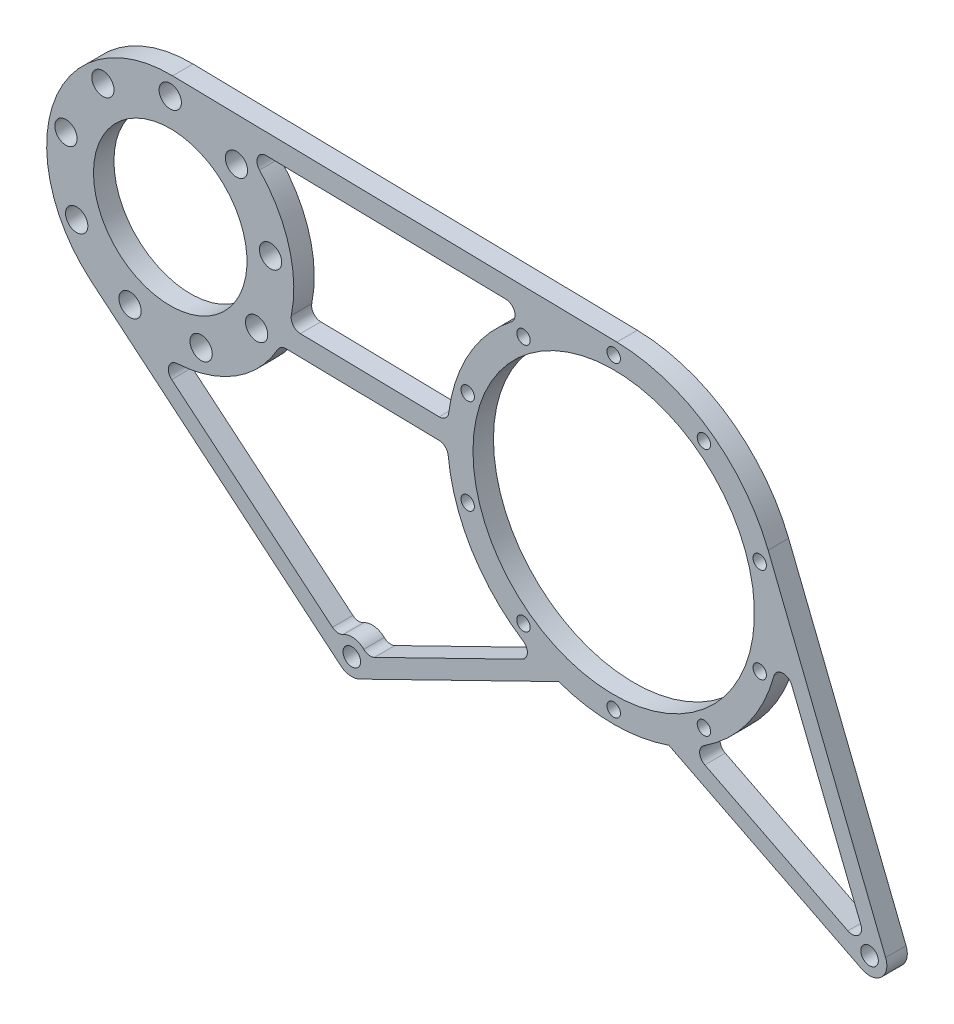
from build123d import *

# Parameters (mm, degrees)
SKETCH2_R               = 28.575
SKETCH2_R_2             = 3.2639
SKETCH2_R_3             = 52.3875
BOSS_EXTRUDE1_DEPTH     = 7.62
CUT_EXTRUDE1_DEPTH      = 369.60849746
CUT_EXTRUDE1_DEPTH_BACK = 369.60849746
SKETCH3_R               = 4.15
SKETCH3_R_2             = 2.5
CUT_EXTRUDE2_DEPTH      = 369.60849746
CUT_EXTRUDE2_DEPTH_BACK = 369.60849746


with BuildPart() as part:
    # Sketch2 → Boss-Extrude1 (new body)
    with BuildSketch(Plane.XY):
        with BuildLine():
            Line((-308.875210247, 91.684111495), (-215.925303767, 14.10662012))
            ThreePointArc((-215.925303767, 14.10662012), (-212.572234871, 12.65763879), (-208.970475069, 13.265869211))
            Line((-208.970475069, 13.265869211), (-134.814952137, 49.535152614))
            ThreePointArc((-134.814952137, 49.535152614), (-114.3, 46.0375), (-93.785047863, 49.535152614))
            Line((-93.785047863, 49.535152614), (-21.949808906, 13.301039962))
            ThreePointArc((-21.949808906, 13.301039962), (-14.699565425, 14.303090245), (-13.070560605, 21.438668609))
            Line((-13.070560605, 21.438668609), (-56.805390428, 130.917967399))
            ThreePointArc((-56.805390428, 130.917967399), (-79.093597182, 158.878055695), (-113.124724735, 169.851343962))
            Line((-113.124724735, 169.851343962), (-278.526789224, 172.991711242))
            ThreePointArc((-278.526789224, 172.991711242), (-322.495823899, 143.085706774), (-308.875210247, 91.684111495))
        make_face()
        with Locations((-279.4, 127)):
            Circle(SKETCH2_R, mode=Mode.SUBTRACT)
        with Locations((-19.05, 19.05)):
            Circle(SKETCH2_R_2, mode=Mode.SUBTRACT)
        with Locations((-211.799479175, 19.05)):
            Circle(SKETCH2_R_2, mode=Mode.SUBTRACT)
        with Locations((-114.3, 107.95)):
            Circle(SKETCH2_R_3, mode=Mode.SUBTRACT)
    extrude(amount=BOSS_EXTRUDE1_DEPTH)

    # Sketch3 → Cut-Extrude1 (cut, two sides: drawn at the far end of the back side and taken through both)
    with BuildSketch(Plane.XY.offset(7.62).offset(-CUT_EXTRUDE1_DEPTH_BACK)):
        with Locations((-279.4, 166.00043)):
            Circle(SKETCH3_R)
        with Locations((-254.746524018, 156.380868571)):
            Circle(SKETCH3_R)
        with Locations((-242.044200635, 133.164908097)):
            Circle(SKETCH3_R)
        with Locations((-247.236588134, 107.215554499)):
            Circle(SKETCH3_R)
        with Locations((-267.894110695, 90.674798722)):
            Circle(SKETCH3_R)
        with Locations((-294.35088393, 91.282244222)):
            Circle(SKETCH3_R)
        with Locations((-314.227489609, 108.753660501)):
            Circle(SKETCH3_R)
        with Locations((-318.223443029, 134.913977707)):
            Circle(SKETCH3_R)
        with Locations((-304.468993176, 157.522492681)):
            Circle(SKETCH3_R)
        with Locations((-114.3, 165.1)):
            Circle(SKETCH3_R_2)
        with Locations((-80.708072831, 154.185321229)):
            Circle(SKETCH3_R_2)
        with Locations((-59.947120094, 125.610321229)):
            Circle(SKETCH3_R_2)
        with Locations((-59.947120094, 90.289678771)):
            Circle(SKETCH3_R_2)
        with Locations((-80.708072831, 61.714678771)):
            Circle(SKETCH3_R_2)
        with Locations((-114.3, 50.8)):
            Circle(SKETCH3_R_2)
        with Locations((-147.891927169, 61.714678771)):
            Circle(SKETCH3_R_2)
        with Locations((-168.652879906, 90.289678771)):
            Circle(SKETCH3_R_2)
        with Locations((-168.652879906, 125.610321229)):
            Circle(SKETCH3_R_2)
        with Locations((-147.891927169, 154.185321229)):
            Circle(SKETCH3_R_2)
    extrude(amount=CUT_EXTRUDE1_DEPTH + CUT_EXTRUDE1_DEPTH_BACK, mode=Mode.SUBTRACT)

    # Sketch4 → Cut-Extrude2 (cut, two sides: drawn at the far end of the back side and taken through both)
    with BuildSketch(Plane.XY.offset(7.62).offset(-CUT_EXTRUDE2_DEPTH_BACK)):
        with BuildLine():
            Line((-278.860225121, 74.904185455), (-219.01939843, 24.960066172))
            ThreePointArc((-219.01939843, 24.960066172), (-217.078020776, 24.161494872), (-215.029526872, 24.620118947))
            ThreePointArc((-215.029526872, 24.620118947), (-211.026723478, 25.44236121), (-207.335161059, 23.689967346))
            ThreePointArc((-207.335161059, 23.689967346), (-205.454963796, 22.756414152), (-203.379217054, 23.069365873))
            Line((-203.379217054, 23.069365873), (-148.393096208, 49.962941986))
            ThreePointArc((-148.393096208, 49.962941986), (-146.441473652, 52.888826728), (-148.025123052, 56.029158988))
            ThreePointArc((-148.025123052, 56.029158988), (-167.202514386, 75.786641533), (-175.91672865, 101.90546472))
            ThreePointArc((-175.91672865, 101.90546472), (-177.022168822, 104.129423143), (-179.326246533, 105.05636162))
            Line((-179.326246533, 105.05636162), (-236.248291515, 106.1370986))
            ThreePointArc((-236.248291515, 106.1370986), (-238.04588498, 105.678406249), (-239.35496486, 104.363852787))
            ThreePointArc((-239.35496486, 104.363852787), (-255.112552192, 87.934415671), (-276.81836003, 81.072501319))
            ThreePointArc((-276.81836003, 81.072501319), (-279.937917376, 78.683040095), (-278.860225121, 74.904185455))
        make_face()
        with BuildLine():
            Line((-48.019318761, 91.807143198), (-22.303873454, 27.434904147))
            ThreePointArc((-22.303873454, 27.434904147), (-23.187455951, 23.564521405), (-27.120033775, 23.021003007))
            Line((-27.120033775, 23.021003007), (-80.387932313, 49.889641079))
            ThreePointArc((-80.387932313, 49.889641079), (-82.302626367, 52.822384958), (-80.709884678, 55.941714036))
            ThreePointArc((-80.709884678, 55.941714036), (-64.405072396, 71.294115674), (-54.62867895, 91.442695545))
            ThreePointArc((-54.62867895, 91.442695545), (-51.454892751, 93.998716793), (-48.019318761, 91.807143198))
        make_face()
        with BuildLine():
            Line((-243.572637688, 164.706689191), (-154.458722757, 163.014748867))
            ThreePointArc((-154.458722757, 163.014748867), (-151.211699304, 160.627169805), (-152.377082357, 156.768986628))
            ThreePointArc((-152.377082357, 156.768986628), (-168.115145357, 138.561889625), (-175.721811685, 115.729376938))
            ThreePointArc((-175.721811685, 115.729376938), (-176.902393858, 113.526279988), (-179.252929411, 112.6763429))
            Line((-179.252929411, 112.6763429), (-230.963872105, 113.658140516))
            ThreePointArc((-230.963872105, 113.658140516), (-233.622605418, 114.965574686), (-234.320208682, 117.845087947))
            ThreePointArc((-234.320208682, 117.845087947), (-235.210231249, 139.777493405), (-246.162459408, 158.800407158))
            ThreePointArc((-246.162459408, 158.800407158), (-246.837455621, 162.61732476), (-243.572637688, 164.706689191))
        make_face()
    extrude(amount=CUT_EXTRUDE2_DEPTH + CUT_EXTRUDE2_DEPTH_BACK, mode=Mode.SUBTRACT)


solid = part.part
